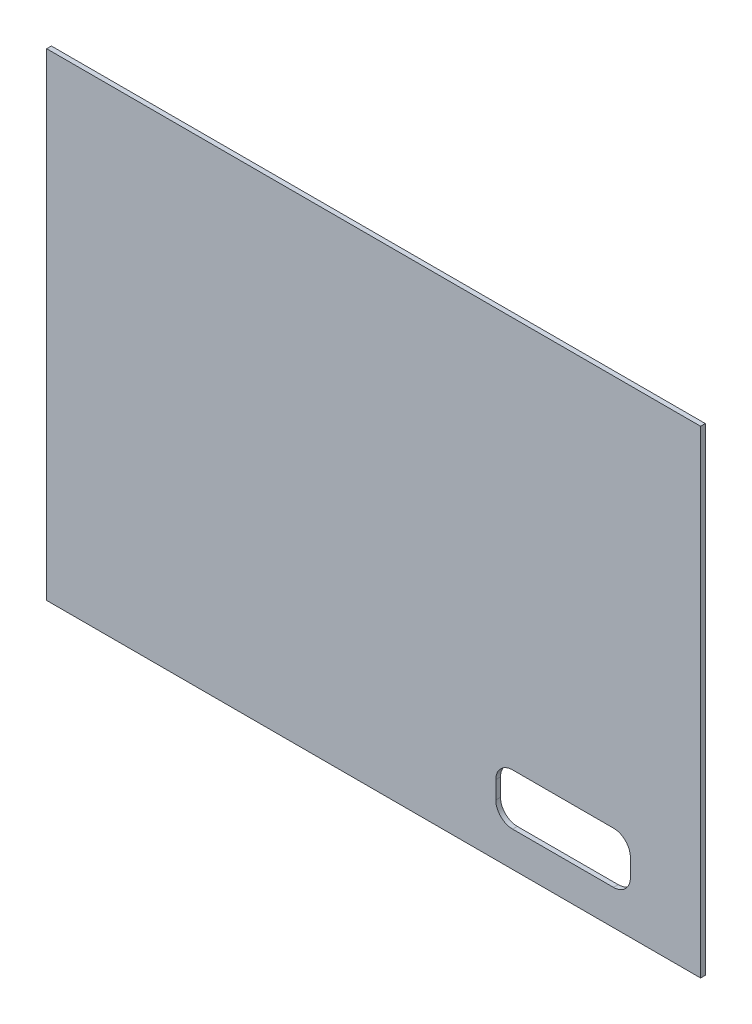
from build123d import *

# Parameters (mm, degrees)
SKETCH1_W           = 97.16644
SKETCH1_H           = 71
SKETCH1_W_2         = 20
SKETCH1_H_2         = 7.62
BOSS_EXTRUDE2_DEPTH = 0.7
BOSS_EXTRUDE3_DEPTH = 5
FILLET1_R           = 2.5


with BuildPart() as part:
    # Sketch1 → Boss-Extrude2 (new body)
    with BuildSketch(Plane.XY):
        with Locations((48.58322, 35.5)):
            Rectangle(SKETCH1_W, SKETCH1_H)
        with Locations((76.731936, 9.000673)):
            Rectangle(SKETCH1_W_2, SKETCH1_H_2, mode=Mode.SUBTRACT)
    extrude(amount=BOSS_EXTRUDE2_DEPTH)

    # Sketch1<4> → Boss-Extrude3 (add)
    with BuildSketch(Plane.XY):
        Polygon((25.266348, 63.75), (18.516348, 47.55), (18.516348, 37.85), (25.266348, 54.05), align=None)
        Polygon((10.891348, 64.75), (15.516348, 53.65), (20.141348, 64.75), align=None)
        Polygon((5.766348, 63.75), (5.766348, 54.05), (12.516348, 37.85), (12.516348, 47.55), align=None)
        Polygon((71.900092, 54.05), (78.650092, 37.85), (78.650092, 47.55), (71.900092, 63.75), align=None)
        Polygon((77.025092, 64.75), (81.650092, 53.65), (86.275092, 64.75), align=None)
        Polygon((91.400092, 63.75), (84.650092, 47.55), (84.650092, 37.85), (91.400092, 54.05), align=None)
    extrude(amount=-BOSS_EXTRUDE3_DEPTH)

    # Fillet1
    fillet1_edges = [part.edges().sort_by_distance(p)[0] for p in [
        (66.731936, 5.190673, 0.35),
        (66.731936, 12.810673, 0.35),
        (86.731936, 12.810673, 0.35),
        (86.731936, 5.190673, 0.35),
    ]]
    fillet(fillet1_edges, radius=FILLET1_R)


solid = part.part
